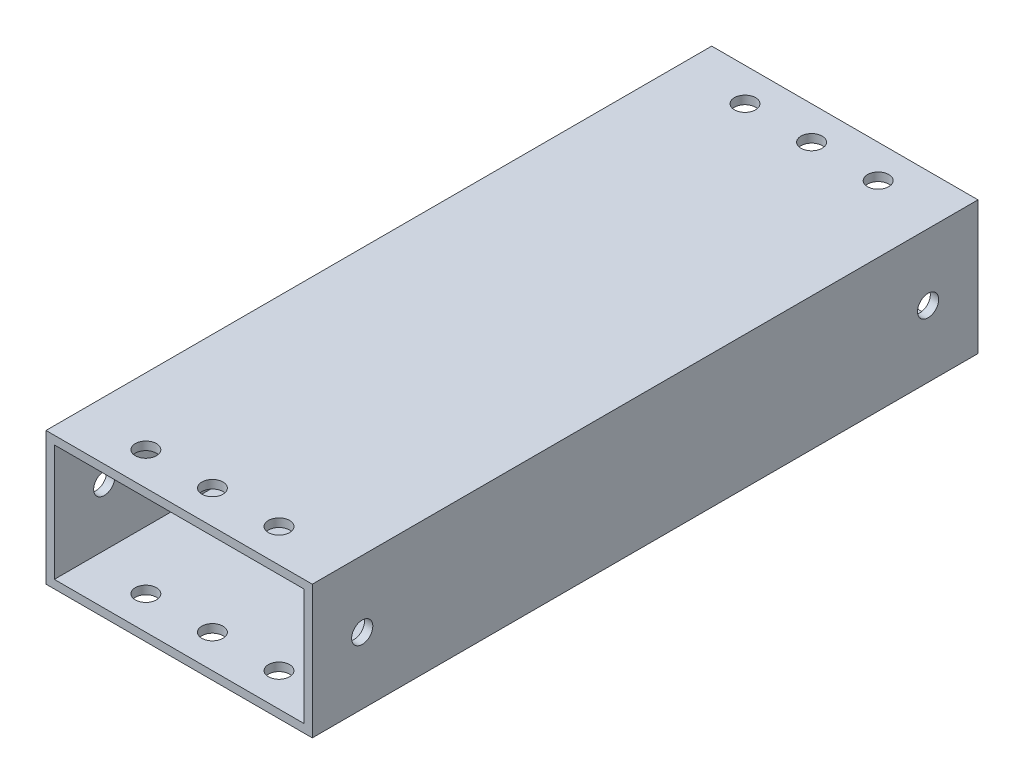
from build123d import *

# Parameters (mm, degrees)
SKETCH1_W           = 50.8
SKETCH1_H           = 25.4
SKETCH1_W_2         = 47.625
SKETCH1_H_2         = 22.225
BOSS_EXTRUDE1_DEPTH = 63.5
SKETCH2_R           = 2.0193
CUT_EXTRUDE1_DEPTH  = 73.955945611
SKETCH3_R           = 2.0193
CUT_EXTRUDE2_DEPTH  = 83.30540687


with BuildPart() as part:
    # Sketch1 → Boss-Extrude1 (new, symmetric)
    with BuildSketch(Plane.XY):
        Rectangle(SKETCH1_W, SKETCH1_H)
        Rectangle(SKETCH1_W_2, SKETCH1_H_2, mode=Mode.SUBTRACT)
    extrude(amount=BOSS_EXTRUDE1_DEPTH, both=True)

    # Sketch2 → Cut-Extrude1 (cut, through all)
    with BuildSketch(Plane(origin=(0, 12.7, 0), x_dir=(1, 0, 0), z_dir=(0, 1, 0))):
        with Locations((-12.7, 57.15)):
            Circle(SKETCH2_R)
        with Locations((0, 57.15)):
            Circle(SKETCH2_R)
        with Locations((12.7, 57.15)):
            Circle(SKETCH2_R)
        with Locations((12.7, -57.15)):
            Circle(SKETCH2_R)
        with Locations((0, -57.15)):
            Circle(SKETCH2_R)
        with Locations((-12.7, -57.15)):
            Circle(SKETCH2_R)
    extrude(amount=-CUT_EXTRUDE1_DEPTH, mode=Mode.SUBTRACT)

    # Sketch3 → Cut-Extrude2 (cut, through all)
    with BuildSketch(Plane(origin=(25.4, 0, 0), x_dir=(0, 0, -1), z_dir=(1, 0, 0))):
        with Locations((-53.975, 0)):
            Circle(SKETCH3_R)
        with Locations((53.975, 0)):
            Circle(SKETCH3_R)
    extrude(amount=-CUT_EXTRUDE2_DEPTH, mode=Mode.SUBTRACT)


solid = part.part
